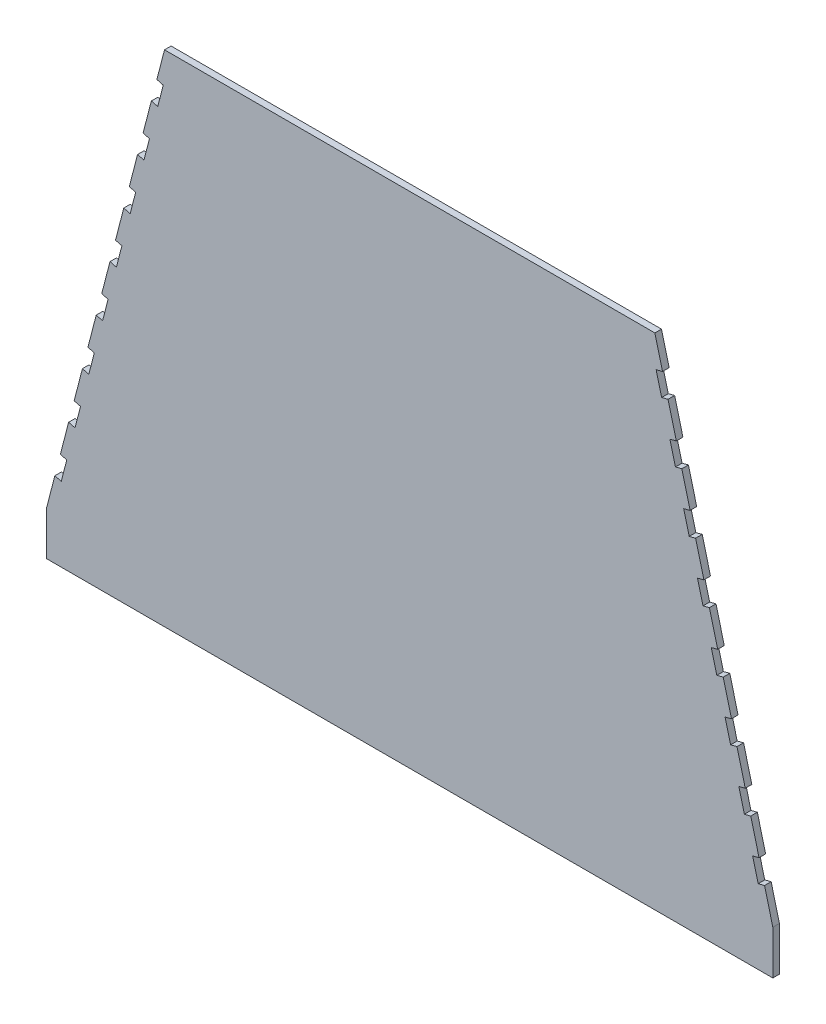
from build123d import *

# Parameters (mm, degrees)
BOSS_EXTRUDE1_DEPTH  = 3
CUT_EXTRUDE1_DEPTH   = 3
LPATTERN1_COUNT      = 8
LPATTERN1_PITCH      = 25
MIRROR1_COPY_1_DEPTH = 3
MIRROR1_COPY_2_DEPTH = 3
MIRROR1_COPY_3_DEPTH = 3
MIRROR1_COPY_4_DEPTH = 3
MIRROR1_COPY_5_DEPTH = 3
MIRROR1_COPY_6_DEPTH = 3
MIRROR1_COPY_7_DEPTH = 3
MIRROR1_COPY_8_DEPTH = 3


with BuildPart() as part:
    # Sketch2 → Boss-Extrude1 (new body)
    with BuildSketch(Plane.XY):
        Polygon((111.410161514, 164.35009364), (-111.410161514, 164.35009364), (-165, -42.705142442), (-165, -62.705142442), (165, -62.705142442), (165, -42.705142442), align=None)
    extrude(amount=BOSS_EXTRUDE1_DEPTH)

    # Sketch3 → Cut-Extrude1 (cut)
    with BuildSketch(Plane(origin=(0, 0, 0), x_dir=(-1, 0, 0), z_dir=(0, 0, -1))):
        Polygon((-161.241557894, -28.183637254), (-158.337256856, -28.935325675), (-155.831628785, -19.254322216), (-158.735929823, -18.502633795), align=None)
    cut_extrude1 = extrude(amount=-CUT_EXTRUDE1_DEPTH, mode=Mode.SUBTRACT)

    # LPattern1: Cut-Extrude1 ×8
    with Locations(*[Vector(-0.2505628070857316, 0.9681003458863748, 0) * (i * LPATTERN1_PITCH) for i in range(1, LPATTERN1_COUNT)]):
        add(cut_extrude1, mode=Mode.SUBTRACT)

    # Mirror1 copy 1 sketch → Mirror1 copy 1 (cut)
    with BuildSketch(Plane(origin=(6.264070177, 24.202508647, 0), x_dir=(1, 0, 0), z_dir=(0, 0, -1))):
        Polygon((-161.241557894, 28.183637254), (-158.337256856, 28.935325675), (-155.831628785, 19.254322216), (-158.735929823, 18.502633795), align=None)
    extrude(amount=-MIRROR1_COPY_1_DEPTH, mode=Mode.SUBTRACT)

    # Mirror1 copy 2 sketch → Mirror1 copy 2 (cut)
    with BuildSketch(Plane(origin=(12.528140354, 48.405017294, 0), x_dir=(1, 0, 0), z_dir=(0, 0, -1))):
        Polygon((-161.241557894, 28.183637254), (-158.337256856, 28.935325675), (-155.831628785, 19.254322216), (-158.735929823, 18.502633795), align=None)
    extrude(amount=-MIRROR1_COPY_2_DEPTH, mode=Mode.SUBTRACT)

    # Mirror1 copy 3 sketch → Mirror1 copy 3 (cut)
    with BuildSketch(Plane(origin=(18.792210531, 72.607525941, 0), x_dir=(1, 0, 0), z_dir=(0, 0, -1))):
        Polygon((-161.241557894, 28.183637254), (-158.337256856, 28.935325675), (-155.831628785, 19.254322216), (-158.735929823, 18.502633795), align=None)
    extrude(amount=-MIRROR1_COPY_3_DEPTH, mode=Mode.SUBTRACT)

    # Mirror1 copy 4 sketch → Mirror1 copy 4 (cut)
    with BuildSketch(Plane(origin=(25.056280709, 96.810034589, 0), x_dir=(1, 0, 0), z_dir=(0, 0, -1))):
        Polygon((-161.241557894, 28.183637254), (-158.337256856, 28.935325675), (-155.831628785, 19.254322216), (-158.735929823, 18.502633795), align=None)
    extrude(amount=-MIRROR1_COPY_4_DEPTH, mode=Mode.SUBTRACT)

    # Mirror1 copy 5 sketch → Mirror1 copy 5 (cut)
    with BuildSketch(Plane(origin=(31.320350886, 121.012543236, 0), x_dir=(1, 0, 0), z_dir=(0, 0, -1))):
        Polygon((-161.241557894, 28.183637254), (-158.337256856, 28.935325675), (-155.831628785, 19.254322216), (-158.735929823, 18.502633795), align=None)
    extrude(amount=-MIRROR1_COPY_5_DEPTH, mode=Mode.SUBTRACT)

    # Mirror1 copy 6 sketch → Mirror1 copy 6 (cut)
    with BuildSketch(Plane(origin=(37.584421063, 145.215051883, 0), x_dir=(1, 0, 0), z_dir=(0, 0, -1))):
        Polygon((-161.241557894, 28.183637254), (-158.337256856, 28.935325675), (-155.831628785, 19.254322216), (-158.735929823, 18.502633795), align=None)
    extrude(amount=-MIRROR1_COPY_6_DEPTH, mode=Mode.SUBTRACT)

    # Mirror1 copy 7 sketch → Mirror1 copy 7 (cut)
    with BuildSketch(Plane(origin=(43.84849124, 169.41756053, 0), x_dir=(1, 0, 0), z_dir=(0, 0, -1))):
        Polygon((-161.241557894, 28.183637254), (-158.337256856, 28.935325675), (-155.831628785, 19.254322216), (-158.735929823, 18.502633795), align=None)
    extrude(amount=-MIRROR1_COPY_7_DEPTH, mode=Mode.SUBTRACT)

    # Mirror1 copy 8 sketch → Mirror1 copy 8 (cut)
    with BuildSketch(Plane(origin=(0, 0, 0), x_dir=(1, 0, 0), z_dir=(0, 0, -1))):
        Polygon((-161.241557894, 28.183637254), (-158.337256856, 28.935325675), (-155.831628785, 19.254322216), (-158.735929823, 18.502633795), align=None)
    extrude(amount=-MIRROR1_COPY_8_DEPTH, mode=Mode.SUBTRACT)


solid = part.part
